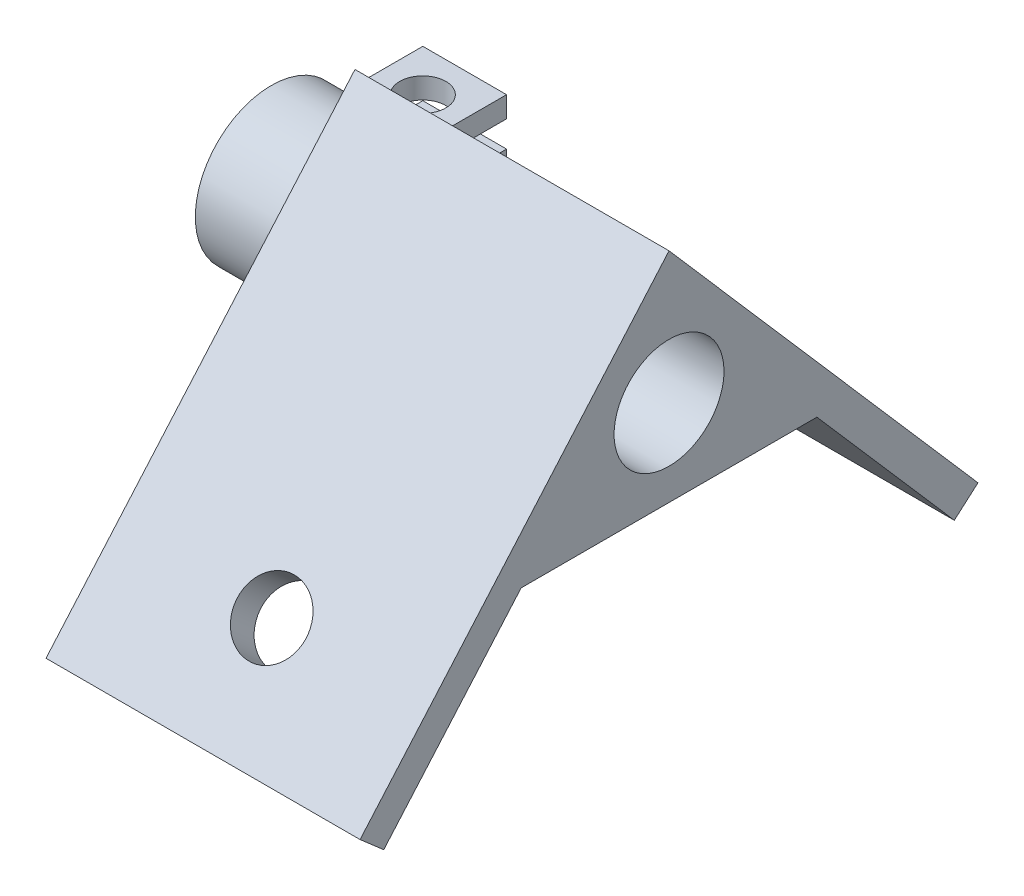
from build123d import *

# Parameters (mm, degrees)
SKETCH1_R            = 5.25
BOSS_EXTRUDE1_DEPTH  = 15
M6_CLEARANCE_HOLE1_D = 6.6
BOSS_EXTRUDE2_START  = 8
BOSS_EXTRUDE2_DEPTH  = 8
SKETCH6_R            = 2.2
CUT_EXTRUDE1_DEPTH   = 46.905147279


with BuildPart() as part:
    # Sketch1 → Boss-Extrude1 (new, symmetric)
    with BuildSketch(Plane(origin=(0, 0, 0), x_dir=(0, 0, -1), z_dir=(1, 0, 0))):
        Polygon((0, 12.575087965), (-29.513243123, -21.376014517), (-27.249114382, -23.344191604), (-14.127933802, -8.25), (14.127933802, -8.25), (27.249114382, -23.344191604), (29.513243123, -21.376014517), align=None)
        Circle(SKETCH1_R, mode=Mode.SUBTRACT)
    extrude(amount=BOSS_EXTRUDE1_DEPTH, both=True)

    # M6 Clearance Hole1 (through all)
    with Locations(Plane(origin=(0, 3.444309902, 3.962225296), x_dir=(-1, 0, 0), z_dir=(0, -0.6560590289905083, -0.7547095802227711))):
        with Locations((0, -25.495112569)):
            m6_clearance_hole1 = Hole(M6_CLEARANCE_HOLE1_D / 2)

    # Mirror1: M6 Clearance Hole1 across plane
    add(m6_clearance_hole1.mirror(Plane.XY), mode=Mode.SUBTRACT)

    # Sketch5 → Boss-Extrude2 (add)
    with BuildSketch(Plane.ZY.offset(15).offset(BOSS_EXTRUDE2_START)):
        with BuildLine():
            Line((-5.099019514, 1.25), (-14.480740698, 1.25))
            Line((-14.480740698, 1.25), (-14.480740698, 3.25))
            Line((-14.480740698, 3.25), (-6.480740698, 3.25))
            ThreePointArc((-6.480740698, 3.25), (7.25, 0), (-6.480740698, -3.25))
            Line((-6.480740698, -3.25), (-6.480740698, -10.25))
            Line((-6.480740698, -10.25), (-14.480740698, -10.25))
            Line((-14.480740698, -10.25), (-14.480740698, -1.25))
            Line((-14.480740698, -1.25), (-5.099019514, -1.25))
            ThreePointArc((-5.099019514, -1.25), (5.25, 0), (-5.099019514, 1.25))
        make_face()
    extrude(amount=-BOSS_EXTRUDE2_DEPTH)

    # Sketch6 → Cut-Extrude1 (cut, through all)
    with BuildSketch(Plane(origin=(0, 3.25, 0), x_dir=(1, 0, 0), z_dir=(0, 1, 0))):
        with Locations((-19, 10.480740698)):
            Circle(SKETCH6_R)
    extrude(amount=-CUT_EXTRUDE1_DEPTH, mode=Mode.SUBTRACT)


solid = part.part
